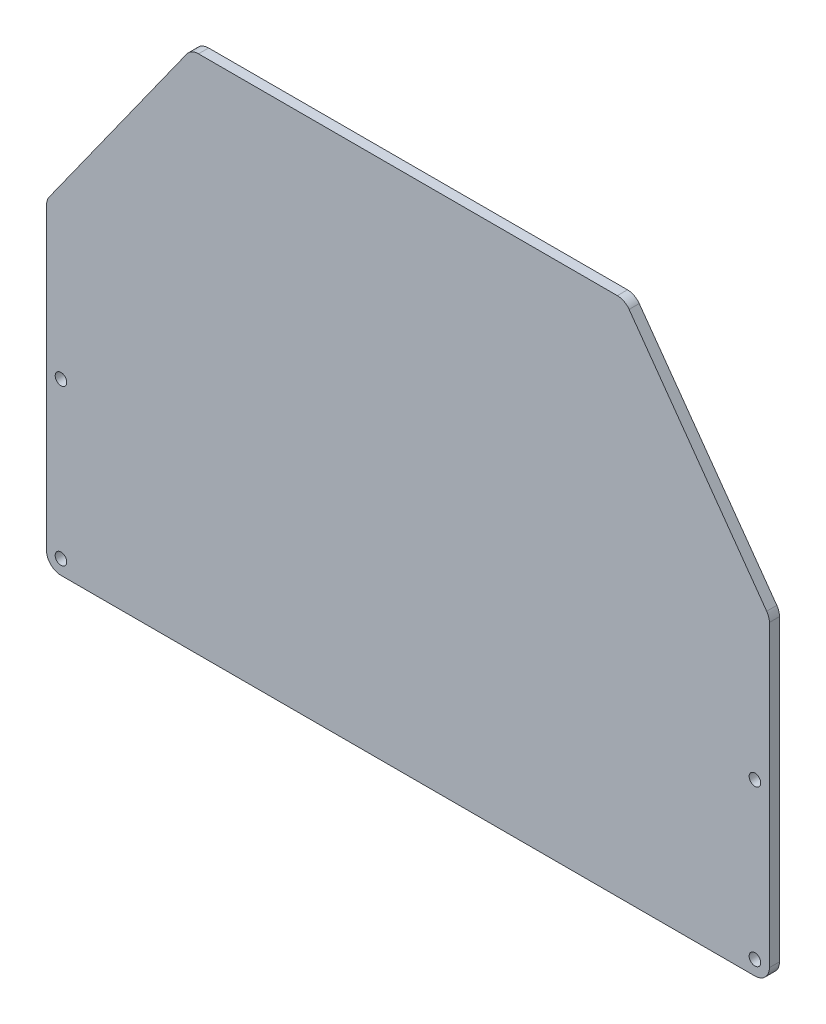
from build123d import *

# Parameters (mm, degrees)
BOSS_EXTRU_1_DEPTH           = 3.5
ESQUISSE2_R                  = 2
ENL_V_MAT_EXTRU_1_DEPTH      = 395.382111663
ENL_V_MAT_EXTRU_2_DEPTH      = 395.382111663
ENL_V_MAT_EXTRU_2_DEPTH_BACK = 395.382111663
CONG_1_R                     = 5


with BuildPart() as part:
    # Esquisse1 → Boss.-Extru.1 (new body)
    with BuildSketch(Plane.XY):
        with BuildLine():
            Line((5, 0), (245, 0))
            ThreePointArc((245, 0), (248.535533906, 1.464466094), (250, 5))
            Line((250, 5), (250, 305))
            Line((250, 305), (0, 305))
            Line((0, 305), (0, 5))
            ThreePointArc((0, 5), (1.464466094, 1.464466094), (5, 0))
        make_face()
    extrude(amount=BOSS_EXTRU_1_DEPTH)

    # Esquisse2 → Enlèv. mat.-Extru.1 (cut, through all)
    with BuildSketch(Plane.XY.offset(3.5)):
        with Locations((5, 5)):
            Circle(ESQUISSE2_R)
        with Locations((245, 5)):
            Circle(ESQUISSE2_R)
        with Locations((5, 58.8)):
            Circle(ESQUISSE2_R)
        with Locations((245, 58.8)):
            Circle(ESQUISSE2_R)
    extrude(amount=-ENL_V_MAT_EXTRU_1_DEPTH, mode=Mode.SUBTRACT)

    # Esquisse3 → Enlèv. mat.-Extru.2 (cut, two sides: drawn at the far end of the back side and taken through both)
    with BuildSketch(Plane.XY.offset(3.5).offset(-ENL_V_MAT_EXTRU_2_DEPTH_BACK)):
        Polygon((-374.383398967, -414.136758554), (0, 110), (50, 180), (200, 180), (250, 110), (624.383398967, -414.136758554), (624.383398967, 874.090350445), (-374.383398967, 874.090350445), align=None)
    extrude(amount=ENL_V_MAT_EXTRU_2_DEPTH + ENL_V_MAT_EXTRU_2_DEPTH_BACK, mode=Mode.SUBTRACT)

    # Congé1
    cong_1_edges = [part.edges().sort_by_distance(p)[0] for p in [
        (250, 110, 1.75),
        (200, 180, 1.75),
        (50, 180, 1.75),
        (0, 110, 1.75),
    ]]
    fillet(cong_1_edges, radius=CONG_1_R)


solid = part.part
